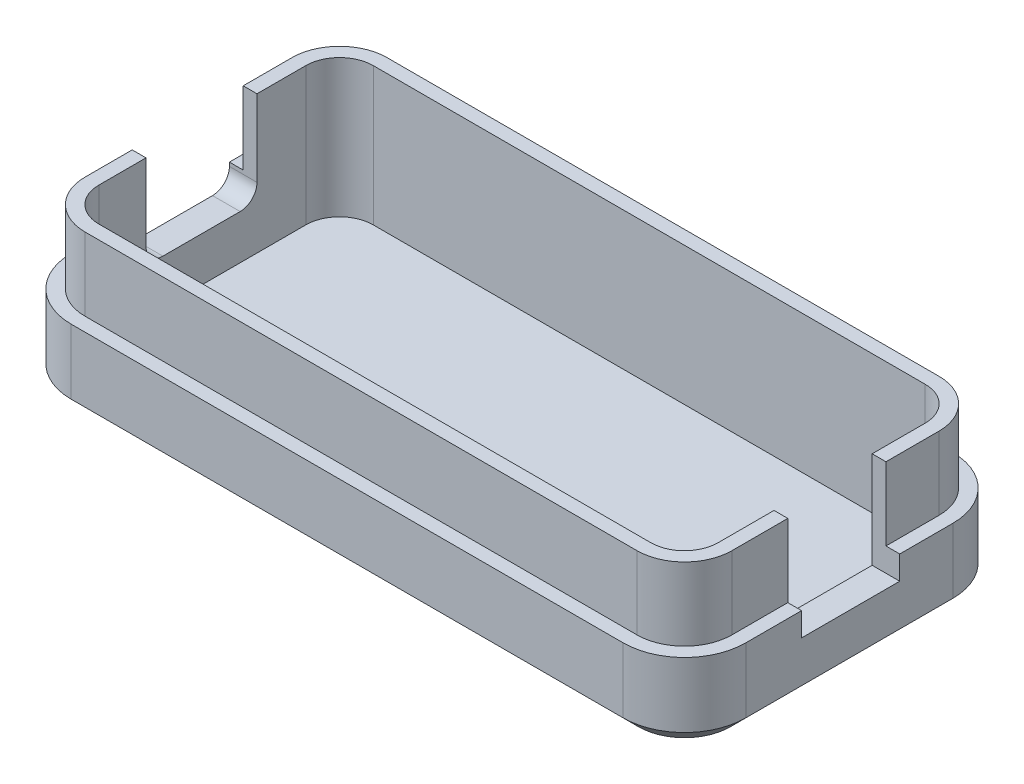
from build123d import *

# Parameters (mm, degrees)
BOSS_EXTRUDE1_DEPTH      = 1.27
BOSS_EXTRUDE2_DEPTH      = 5.385
BOSS_EXTRUDE4_DEPTH      = 6.044
SKETCH5_W                = 2.286
SKETCH5_H                = 9.194
CUT_EXTRUDE1_DEPTH       = 7.751
FILLET1_R                = 1.397
SKETCH6_W                = 2.286
SKETCH6_H                = 8.128
CUT_EXTRUDE2_DEPTH       = 8.001
CHAMFER1_SIZE            = 1.27
CUT_EXTRUDE3_START       = -0.625
CUT_EXTRUDE3_OUTLINE_W   = 4.757935664
CUT_EXTRUDE3_OUTLINE_H   = 4.757935664
CUT_EXTRUDE3_OUTLINE_W_2 = 4.757935127
CUT_EXTRUDE3_OUTLINE_H_2 = 1.994134757
CUT_EXTRUDE3_DEPTH       = 0.625


# Read off the part's stored shape, not the designer's step: Cut-Extrude3
with BuildPart() as part:
    # Sketch1 → Boss-Extrude1 (new body)
    with BuildSketch(Plane(origin=(0, 0, 0), x_dir=(1, 0, 0), z_dir=(0, 1, 0))):
        with BuildLine():
            Line((-22.86, -13.6525), (22.86, -13.6525))
            ThreePointArc((22.86, -13.6525), (26.452102448, -12.164602448), (27.94, -8.5725))
            Line((27.94, -8.5725), (27.94, 8.5725))
            ThreePointArc((27.94, 8.5725), (26.452102448, 12.164602448), (22.86, 13.6525))
            Line((22.86, 13.6525), (-22.86, 13.6525))
            ThreePointArc((-22.86, 13.6525), (-26.452102448, 12.164602448), (-27.94, 8.5725))
            Line((-27.94, 8.5725), (-27.94, -8.5725))
            ThreePointArc((-27.94, -8.5725), (-26.452102448, -12.164602448), (-22.86, -13.6525))
        make_face()
    extrude(amount=BOSS_EXTRUDE1_DEPTH)

    # Sketch2 → Boss-Extrude2 (add)
    with BuildSketch(Plane(origin=(0, 1.27, 0), x_dir=(1, 0, 0), z_dir=(0, 1, 0))):
        with BuildLine():
            Line((-22.86, 13.6525), (22.86, 13.6525))
            ThreePointArc((22.86, 13.6525), (26.452102448, 12.164602448), (27.94, 8.5725))
            Line((27.94, 8.5725), (27.94, -8.5725))
            ThreePointArc((27.94, -8.5725), (26.452102448, -12.164602448), (22.86, -13.6525))
            Line((22.86, -13.6525), (-22.86, -13.6525))
            ThreePointArc((-22.86, -13.6525), (-26.452102448, -12.164602448), (-27.94, -8.5725))
            Line((-27.94, -8.5725), (-27.94, 8.5725))
            ThreePointArc((-27.94, 8.5725), (-26.452102448, 12.164602448), (-22.86, 13.6525))
        make_face()
        with BuildLine():
            Line((-22.86, -11.3665), (22.86, -11.3665))
            ThreePointArc((22.86, -11.3665), (24.835656347, -10.548156347), (25.654, -8.5725))
            Line((25.654, -8.5725), (25.654, 8.5725))
            ThreePointArc((25.654, 8.5725), (24.835656347, 10.548156347), (22.86, 11.3665))
            Line((22.86, 11.3665), (-22.86, 11.3665))
            ThreePointArc((-22.86, 11.3665), (-24.835656347, 10.548156347), (-25.654, 8.5725))
            Line((-25.654, 8.5725), (-25.654, -8.5725))
            ThreePointArc((-25.654, -8.5725), (-24.835656347, -10.548156347), (-22.86, -11.3665))
        make_face(mode=Mode.SUBTRACT)
    extrude(amount=BOSS_EXTRUDE2_DEPTH)

    # Sketch4 → Boss-Extrude4 (add)
    with BuildSketch(Plane(origin=(0, 6.655, 0), x_dir=(1, 0, 0), z_dir=(0, 1, 0))):
        with BuildLine():
            Line((-26.797, 8.5725), (-26.797, -8.5725))
            ThreePointArc((-26.797, -8.5725), (-25.643879398, -11.356379398), (-22.86, -12.5095))
            Line((-22.86, -12.5095), (22.86, -12.5095))
            ThreePointArc((22.86, -12.5095), (25.643879398, -11.356379398), (26.797, -8.5725))
            Line((26.797, -8.5725), (26.797, 8.5725))
            ThreePointArc((26.797, 8.5725), (25.643879398, 11.356379398), (22.86, 12.5095))
            Line((22.86, 12.5095), (-22.86, 12.5095))
            ThreePointArc((-22.86, 12.5095), (-25.643879398, 11.356379398), (-26.797, 8.5725))
        make_face()
        with BuildLine():
            Line((-22.86, -11.3665), (22.86, -11.3665))
            ThreePointArc((22.86, -11.3665), (24.835656347, -10.548156347), (25.654, -8.5725))
            Line((25.654, -8.5725), (25.654, 8.5725))
            ThreePointArc((25.654, 8.5725), (24.835656347, 10.548156347), (22.86, 11.3665))
            Line((22.86, 11.3665), (-22.86, 11.3665))
            ThreePointArc((-22.86, 11.3665), (-24.835656347, 10.548156347), (-25.654, 8.5725))
            Line((-25.654, 8.5725), (-25.654, -8.5725))
            ThreePointArc((-25.654, -8.5725), (-24.835656347, -10.548156347), (-22.86, -11.3665))
        make_face(mode=Mode.SUBTRACT)
    extrude(amount=BOSS_EXTRUDE4_DEPTH)

    # Sketch5 → Cut-Extrude1 (cut)
    with BuildSketch(Plane(origin=(0, 12.699, 0), x_dir=(1, 0, 0), z_dir=(0, 1, 0))):
        with Locations((-26.797, -0.0685)):
            Rectangle(SKETCH5_W, SKETCH5_H)
    extrude(amount=-CUT_EXTRUDE1_DEPTH, mode=Mode.SUBTRACT)

    # Fillet1
    fillet1_edges = [part.edges().sort_by_distance(p)[0] for p in [
        (-26.797, 4.948, -4.5285),
        (-26.797, 4.948, 4.6655),
    ]]
    fillet(fillet1_edges, radius=FILLET1_R)

    # Sketch6 → Cut-Extrude2 (cut)
    with BuildSketch(Plane(origin=(0, 12.699, 0), x_dir=(1, 0, 0), z_dir=(0, 1, 0))):
        with Locations((26.797, 0.116376305)):
            Rectangle(SKETCH6_W, SKETCH6_H)
    extrude(amount=-CUT_EXTRUDE2_DEPTH, mode=Mode.SUBTRACT)

    # Chamfer1
    chamfer1_edges = [part.edges().sort_by_distance(p)[0] for p in [
        (0, 0, 13.6525),
        (-26.452102448, 0, 12.164602448),
        (-27.94, 0, 0),
        (-26.452102448, 0, -12.164602448),
        (0, 0, -13.6525),
        (26.452102448, 0, -12.164602448),
        (27.94, 0, 0),
        (26.452102448, 0, 12.164602448),
    ]]
    chamfer(chamfer1_edges, length=CHAMFER1_SIZE)

    # Cut-Extrude3 outline → Cut-Extrude3 (cut)
    # profile 1 of 3: a face of its own
    with BuildSketch(Plane.XZ.offset(CUT_EXTRUDE3_START)):
        with BuildLine():
            ThreePointArc((20, 4.704988284), (19.707106781, 5.412095065), (19, 5.704988284))
            Line((19, 5.704988284), (-19, 5.704988284))
            ThreePointArc((-19, 5.704988284), (-19.707106781, 5.412095065), (-20, 4.704988284))
            Line((-20, 4.704988284), (-20, -4.704988284))
            ThreePointArc((-20, -4.704988284), (-19.707106781, -5.412095065), (-19, -5.704988284))
            Line((-19, -5.704988284), (19, -5.704988284))
            ThreePointArc((19, -5.704988284), (19.707106781, -5.412095065), (20, -4.704988284))
            Line((20, -4.704988284), (20, 4.704988284))
        make_face()
        with BuildLine():
            add(Edge.make_bspline(
                [(-17.353010996, -4.20401173), (-16.71806358, -4.20401173), (-16.20333631, -3.689284997), (-16.20333631, -3.054337044)],
                knots=[0, 0, 0, 0, 1, 1, 1, 1], degree=3))
            add(Edge.make_bspline(
                [(-18.502686219, -3.054337044), (-18.502685682, -3.689284997), (-17.987958949, -4.20401173), (-17.353010996, -4.20401173)],
                knots=[0, 0, 0, 0, 1, 1, 1, 1], degree=3))
            add(Edge.make_bspline(
                [(-17.353010996, -1.904662358), (-17.987958949, -1.904662358), (-18.502686219, -2.419389091), (-18.502686219, -3.054337044)],
                knots=[0, 0, 0, 0, 1, 1, 1, 1], degree=3))
            add(Edge.make_bspline(
                [(-16.20333631, -3.054337044), (-16.20333631, -2.419389091), (-16.71806358, -1.904662358), (-17.353010996, -1.904662358)],
                knots=[0, 0, 0, 0, 1, 1, 1, 1], degree=3))
        make_face(mode=Mode.SUBTRACT)
        Polygon((-11.982208729, -4.204009045), (-11.982208729, 2.384798681), (-18.571016455, 2.384798681), (-18.571016455, 4.204009045), (-10.1746606, 4.204009045), (-10.1746606, -4.204009045), align=None, mode=Mode.SUBTRACT)
        with BuildLine():
            add(Edge.make_bspline(
                [(-8.857081522, -2.466428003), (-8.857081522, -3.17778797), (-8.343970577, -3.679236937)],
                knots=[0.499819127, 0.499819127, 0.499819127, 0.500191413, 0.500191413, 0.500191413], degree=2))
            Line((-8.857081522, -2.466428003), (-8.857081522, 2.478091934))
            add(Edge.make_bspline(
                [(-8.343970568, 3.702559804), (-8.857081522, 3.189449393), (-8.857081522, 2.478091934)],
                knots=[0.499801998, 0.499801998, 0.499801998, 0.500172834, 0.500172834, 0.500172834], degree=2))
            add(Edge.make_bspline(
                [(-7.119500446, 4.204009045), (-7.830859344, 4.204009045), (-8.343970568, 3.702559804)],
                knots=[0.499821917, 0.499821917, 0.499821917, 0.500189073, 0.500189073, 0.500189073], degree=2))
            Line((-7.119500446, 4.204009045), (-0.46072513, 4.204009045))
            Line((-0.46072513, 4.204009045), (-0.46072513, -4.192347347))
            Line((-0.46072513, -4.192347347), (-7.119501225, -4.192347347))
            add(Edge.make_bspline(
                [(-8.343970577, -3.679236937), (-7.830859631, -4.192347347), (-7.119501225, -4.192347347)],
                knots=[0.499801999, 0.499801999, 0.499801999, 0.500172835, 0.500172835, 0.500172835], degree=2))
        make_face(mode=Mode.SUBTRACT)
        with BuildLine():
            add(Edge.make_bspline(
                [(0.903863739, -3.667575238), (1.41697388, -4.180685649), (2.128333092, -4.180685649)],
                knots=[0.499802, 0.499802, 0.499802, 0.500172836, 0.500172836, 0.500172836], degree=2))
            add(Edge.make_bspline(
                [(0.390752795, -2.45477126), (0.390752795, -3.154465636), (0.903863739, -3.667575238)],
                knots=[0.499838197, 0.499838197, 0.499838197, 0.50020765, 0.50020765, 0.50020765], degree=2))
            Line((0.390752795, -2.45477126), (0.390752795, -0.285710645))
            add(Edge.make_bspline(
                [(0.903863748, 0.927097736), (0.390752795, 0.413986519), (0.390752795, -0.285710645)],
                knots=[0.499792351, 0.499792351, 0.499792351, 0.500161805, 0.500161805, 0.500161805], degree=2))
            add(Edge.make_bspline(
                [(2.123595668, 1.440202448), (1.415264553, 1.438499481), (0.903863748, 0.927097736)],
                knots=[0.499828399, 0.499828399, 0.499828399, 0.500198, 0.500198, 0.500198], degree=2))
            Line((2.123595668, 1.440202448), (6.979560521, 1.451871446))
            Line((6.979560521, 1.451871446), (6.979560521, 4.20400985))
            Line((6.979560521, 4.20400985), (8.787109187, 4.204009045))
            Line((8.787109187, 4.204009045), (8.787109187, -4.180685649))
            Line((8.787109187, -4.180685649), (2.128333092, -4.180685649))
        make_face(mode=Mode.SUBTRACT)
        with BuildLine():
            add(Edge.make_bspline(
                [(18.467699515, -0.810480301), (18.467699515, -0.099123346), (17.966250804, 0.413986782)],
                knots=[0.499821918, 0.499821918, 0.499821918, 0.500189074, 0.500189074, 0.500189074], degree=2))
            Line((18.467699515, -0.810480301), (18.467699515, -2.46642873))
            add(Edge.make_bspline(
                [(17.966250797, -3.679236945), (18.467699515, -3.177786621), (18.467699515, -2.46642873)],
                knots=[0.499817626, 0.499817626, 0.499817626, 0.500186275, 0.500186275, 0.500186275], degree=2))
            add(Edge.make_bspline(
                [(16.741783686, -4.192347347), (17.453140658, -4.192347347), (17.966250797, -3.679236945)],
                knots=[0.499827166, 0.499827166, 0.499827166, 0.500198002, 0.500198002, 0.500198002], degree=2))
            Line((16.741783686, -4.192347347), (11.79726171, -4.192347347))
            add(Edge.make_bspline(
                [(10.584454061, -3.679236931), (11.09756501, -4.192347347), (11.79726171, -4.192347347)],
                knots=[0.499792351, 0.499792351, 0.499792351, 0.500161805, 0.500161805, 0.500161805], degree=2))
            add(Edge.make_bspline(
                [(10.071343123, -2.466428003), (10.071343123, -3.177787966), (10.584454061, -3.679236931)],
                knots=[0.499819127, 0.499819127, 0.499819127, 0.500191413, 0.500191413, 0.500191413], degree=2))
            Line((10.071343123, -2.466428003), (10.071343123, -1.685102181))
            Line((10.071343123, -1.685102181), (11.902215184, -1.685102181))
            Line((11.902215184, -1.685102181), (11.902215184, -2.373136983))
            Line((11.902215184, -2.373136983), (16.660150849, -2.373136983))
            Line((16.660150849, -2.373136983), (16.660150849, -0.903774333))
            Line((16.660150849, -0.903774333), (11.79726171, -0.903774333))
            add(Edge.make_bspline(
                [(10.584454061, -0.390663916), (11.097565009, -0.903774333), (11.79726171, -0.903774333)],
                knots=[0.499792351, 0.499792351, 0.499792351, 0.500161805, 0.500161805, 0.500161805], degree=2))
            add(Edge.make_bspline(
                [(10.071343123, 0.822144474), (10.071343123, 0.110785586), (10.584454061, -0.390663916)],
                knots=[0.499819128, 0.499819128, 0.499819128, 0.500191414, 0.500191414, 0.500191414], degree=2))
            Line((10.071343123, 0.822144474), (10.071343123, 2.478091934))
            add(Edge.make_bspline(
                [(10.58445407, 3.702559798), (10.071343123, 3.189449389), (10.071343123, 2.478091934)],
                knots=[0.499801998, 0.499801998, 0.499801998, 0.500172834, 0.500172834, 0.500172834], degree=2))
            add(Edge.make_bspline(
                [(11.797262476, 4.204009045), (11.097565296, 4.204009045), (10.58445407, 3.702559798)],
                knots=[0.499833205, 0.499833205, 0.499833205, 0.500198937, 0.500198937, 0.500198937], degree=2))
            Line((11.797262476, 4.204009045), (16.741782958, 4.204009045))
            add(Edge.make_bspline(
                [(17.966250811, 3.702559789), (17.453140406, 4.204009045), (16.741782958, 4.204009045)],
                knots=[0.499810926, 0.499810926, 0.499810926, 0.500178082, 0.500178082, 0.500178082], degree=2))
            add(Edge.make_bspline(
                [(18.467699515, 2.478092714), (18.467699515, 3.189449664), (17.966250811, 3.702559789)],
                knots=[0.499821918, 0.499821918, 0.499821918, 0.500189074, 0.500189074, 0.500189074], degree=2))
            Line((18.467699515, 2.478092714), (18.467699515, 1.696763879))
            Line((18.467699515, 1.696763879), (16.660150849, 1.696763879))
            Line((16.660150849, 1.696763879), (16.660150849, 2.384798681))
            Line((16.660150849, 2.384798681), (11.902215184, 2.384798681))
            Line((11.902215184, 2.384798681), (11.902215184, 0.915436031))
            Line((11.902215184, 0.915436031), (16.741782959, 0.915436031))
            add(Edge.make_bspline(
                [(17.966250804, 0.413986782), (17.453140402, 0.915436031), (16.741782959, 0.915436031)],
                knots=[0.499810926, 0.499810926, 0.499810926, 0.500178082, 0.500178082, 0.500178082], degree=2))
        make_face(mode=Mode.SUBTRACT)
    # profile 2 of 3: a face of its own
    with BuildSketch(Plane.XZ.offset(CUT_EXTRUDE3_START)):
        with Locations((-4.647241628, 0.005830849)):
            Rectangle(CUT_EXTRUDE3_OUTLINE_W, CUT_EXTRUDE3_OUTLINE_H)
    # profile 3 of 3: a face of its own
    with BuildSketch(Plane.XZ.offset(CUT_EXTRUDE3_START)):
        with Locations((4.600592957, -1.376069605)):
            Rectangle(CUT_EXTRUDE3_OUTLINE_W_2, CUT_EXTRUDE3_OUTLINE_H_2)
    extrude(amount=CUT_EXTRUDE3_DEPTH, mode=Mode.SUBTRACT)


solid = part.part
